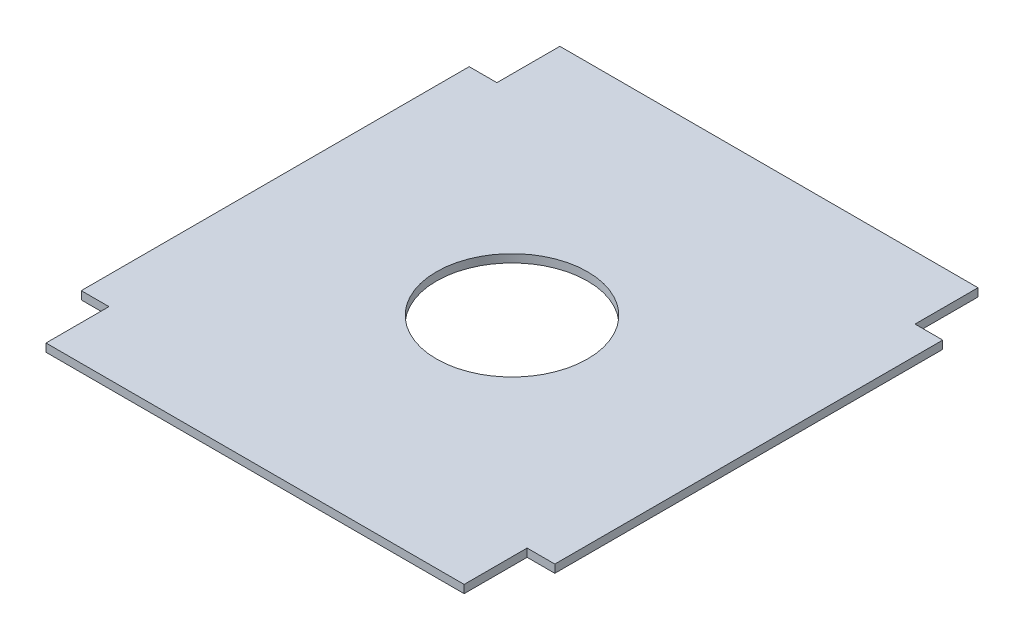
from build123d import *

# Parameters (mm, degrees)
BOSS_EXTRUDE1_DEPTH = 1.6
SKETCH2_R           = 15
CUT_EXTRUDE1_DEPTH  = 1.6


with BuildPart() as part:
    # Sketch1 → Boss-Extrude1 (new body)
    with BuildSketch(Plane(origin=(0, 0, 0), x_dir=(1, 0, 0), z_dir=(0, 1, 0))):
        Polygon((-41.5, 38.5), (-41.5, 51), (41.5, 51), (41.5, 38.5), (47, 38.5), (47, -38.5), (41.5, -38.5), (41.5, -51), (-41.5, -51), (-41.5, -38.5), (-47, -38.5), (-47, 38.5), align=None)
    extrude(amount=BOSS_EXTRUDE1_DEPTH)

    # Sketch2 → Cut-Extrude1 (cut)
    with BuildSketch(Plane(origin=(0, 1.6, 0), x_dir=(1, 0, 0), z_dir=(0, 1, 0))):
        Circle(SKETCH2_R)
    extrude(amount=-CUT_EXTRUDE1_DEPTH, mode=Mode.SUBTRACT)


solid = part.part
